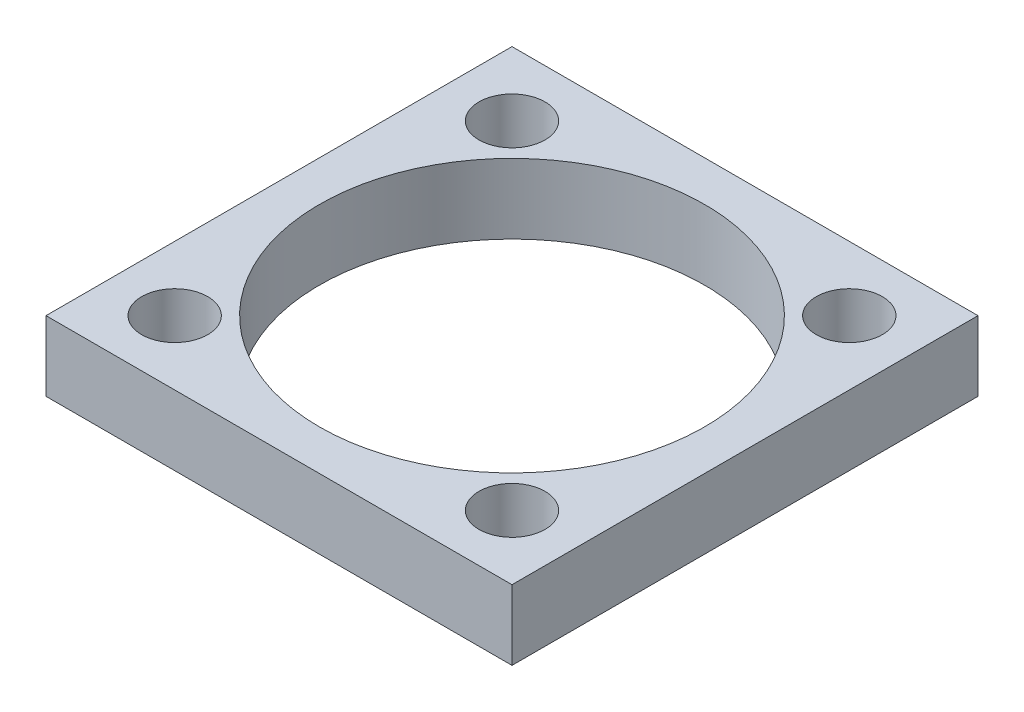
from build123d import *

# Parameters (mm, degrees)
SKETCH2_W            = 25.4
SKETCH2_H            = 25.4
BOSS_EXTRUDE1_DEPTH  = 3.81
SKETCH4_R            = 10.5
CUT_EXTRUDE1_DEPTH   = 19.360177014
M3_CLEARANCE_HOLE2_D = 3.6


with BuildPart() as part:
    # Sketch2 → Boss-Extrude1 (new body)
    with BuildSketch(Plane(origin=(0, 0, 0), x_dir=(1, 0, 0), z_dir=(0, 1, 0))):
        Rectangle(SKETCH2_W, SKETCH2_H)
    extrude(amount=BOSS_EXTRUDE1_DEPTH)

    # Sketch4 → Cut-Extrude1 (cut, through all)
    with BuildSketch(Plane(origin=(0, 3.81, 0), x_dir=(1, 0, 0), z_dir=(0, 1, 0))):
        Circle(SKETCH4_R)
    extrude(amount=-CUT_EXTRUDE1_DEPTH, mode=Mode.SUBTRACT)

    # M3 Clearance Hole2 (through all)
    with Locations(Plane(origin=(-9.192388155, 3.81, -9.192388155), x_dir=(0, 0, 1), z_dir=(0, 1, 0))):
        with Locations((0, 0), (18.38477631, 18.38477631), (0, 18.38477631), (18.38477631, 0)):
            Hole(M3_CLEARANCE_HOLE2_D / 2)


solid = part.part
